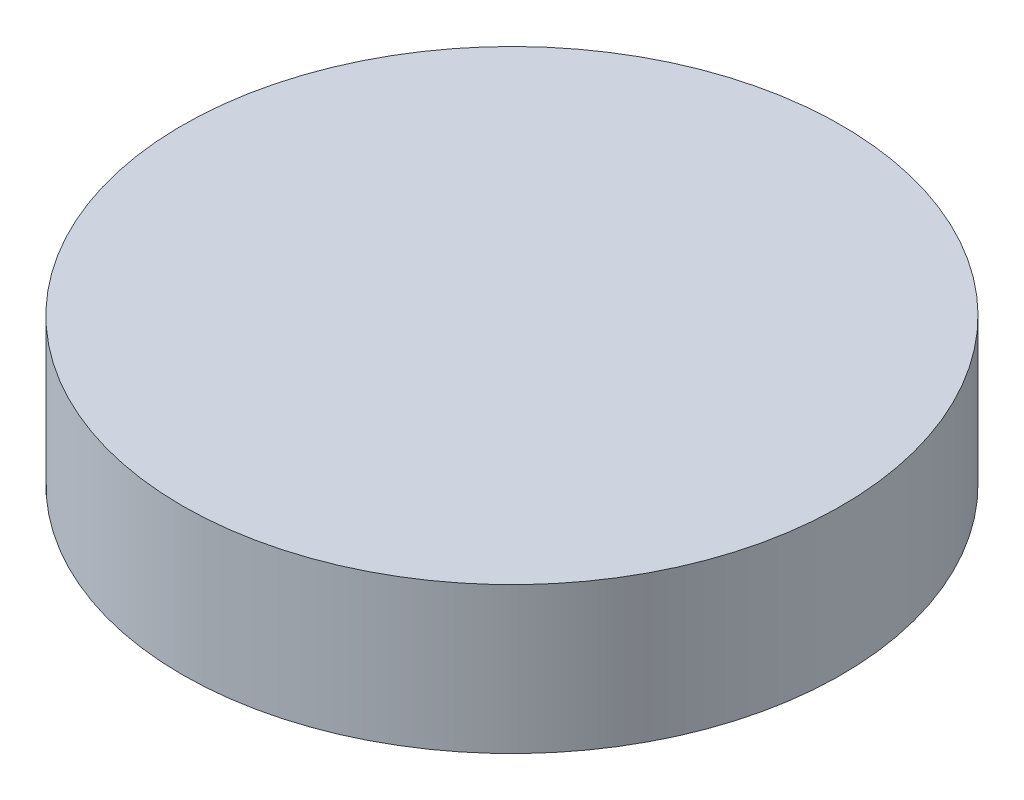
from build123d import *

# Parameters (mm, degrees)
SKETCH1_R           = 18.375
BOSS_EXTRUDE1_DEPTH = 8.156933434


with BuildPart() as part:
    # Sketch1 → Boss-Extrude1 (new body)
    with BuildSketch(Plane(origin=(0, 0, 0), x_dir=(1, 0, 0), z_dir=(0, 1, 0))):
        Circle(SKETCH1_R)
    extrude(amount=BOSS_EXTRUDE1_DEPTH)


solid = part.part
